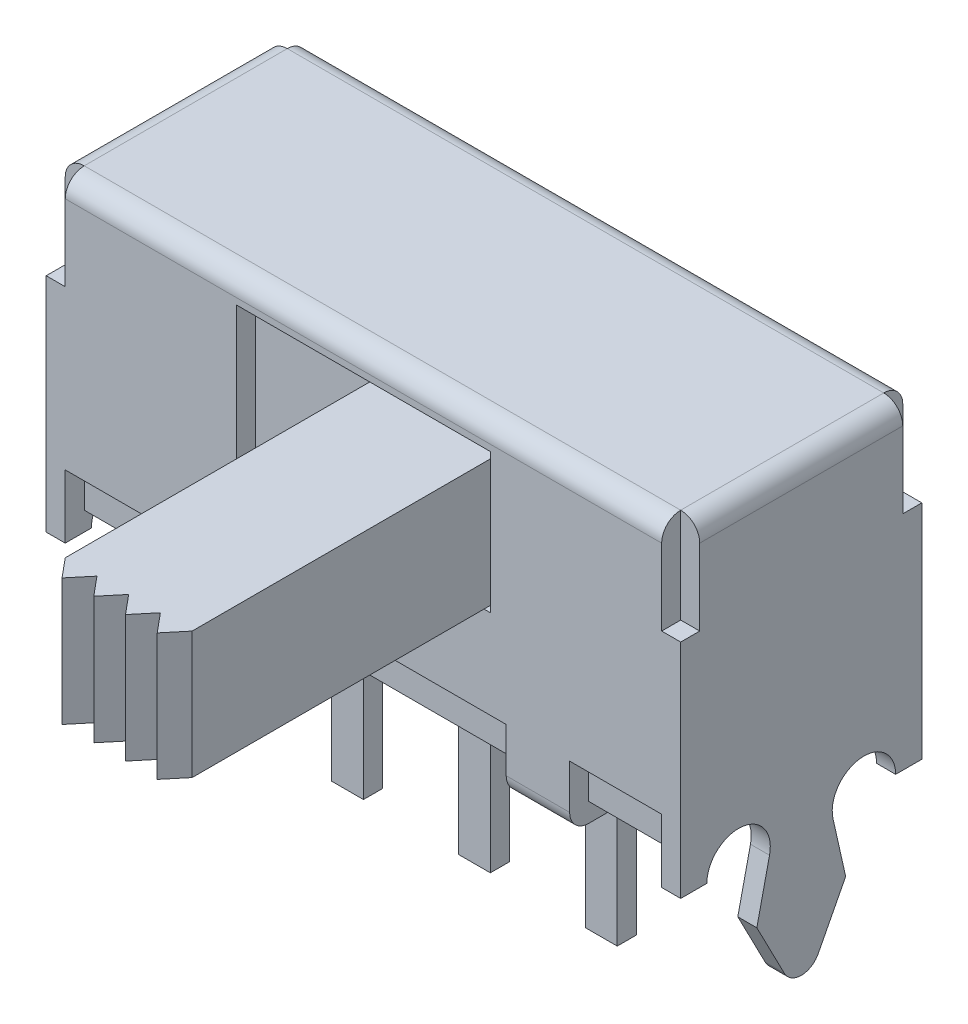
from build123d import *

# Parameters (mm, degrees)
BOSS_EXTRUDE1_DEPTH = 5
SKETCH3_OUTSIDE_W   = 14.556
SKETCH3_OUTSIDE_H   = 8.356
SKETCH3_OUTSIDE_W_2 = 0.5
SKETCH3_OUTSIDE_H_2 = 0.3
SKETCH3_OUTSIDE_W_3 = 0.3
SKETCH3_OUTSIDE_H_3 = 3.8
CUT_EXTRUDE1_DEPTH  = 8.321885003
SKETCH4_W           = 0.5
SKETCH4_H           = 0.3
BOSS_EXTRUDE2_DEPTH = 2.9
SKETCH5_W           = 1.45
SKETCH5_H           = 0.3
SKETCH5_W_2         = 4.5
CUT_EXTRUDE2_DEPTH  = 1
SKETCH6_W           = 9.4
SKETCH6_H           = 3.2
SKETCH6_W_2         = 0.5
SKETCH6_H_2         = 0.3
CUT_EXTRUDE3_DEPTH  = 0.3
SKETCH7_W           = 9.4
SKETCH7_H           = 3.2
BOSS_EXTRUDE3_DEPTH = 0.7
SKETCH8_W           = 1
SKETCH8_H           = 1
BOSS_EXTRUDE4_DEPTH = 0.3
FILLET2_R           = 0.3
SKETCH9_W           = 4
SKETCH9_H           = 2.2
CUT_EXTRUDE4_DEPTH  = 0.3
SKETCH10_W          = 2
SKETCH10_H          = 2
BOSS_EXTRUDE5_DEPTH = 5.3
CUT_EXTRUDE5_DEPTH  = 12.285831826
SKETCH12_R          = 0.125
CUT_EXTRUDE6_DEPTH  = 0.1
SKETCH13_W          = 0.3
SKETCH13_H          = 0.3
CUT_EXTRUDE7_DEPTH  = 1.5


with BuildPart() as part:
    # Sketch2 → Boss-Extrude1 (new, symmetric)
    with BuildSketch(Plane(origin=(0, 0, 0), x_dir=(0, 0, -1), z_dir=(1, 0, 0))):
        with BuildLine():
            Line((-1.6, 5), (1.6, 5))
            ThreePointArc((1.6, 5), (1.812132034, 4.912132034), (1.9, 4.7))
            Line((1.9, 4.7), (1.9, 0))
            Line((1.9, 0), (1.487845372, 0))
            ThreePointArc((1.487845372, 0), (0.932721359, 0.496952053), (0.5, -0.109575967))
            Line((0.5, -0.109575967), (0.7, -1))
            Line((0.7, -1), (0.266442453, -1.837871024))
            ThreePointArc((0.266442453, -1.837871024), (0, -2), (-0.266442453, -1.837871024))
            Line((-0.266442453, -1.837871024), (-0.7, -1))
            Line((-0.7, -1), (-0.5, -0.109575967))
            ThreePointArc((-0.5, -0.109575967), (-0.932721359, 0.496952053), (-1.487845372, 0))
            Line((-1.487845372, 0), (-1.9, 0))
            Line((-1.9, 0), (-1.9, 4.7))
            ThreePointArc((-1.9, 4.7), (-1.812132034, 4.912132034), (-1.6, 5))
        make_face()
    extrude(amount=BOSS_EXTRUDE1_DEPTH, both=True)

    # Sketch3 outside → Cut-Extrude1 (cut, through all)
    with BuildSketch(Plane.XZ):
        Rectangle(SKETCH3_OUTSIDE_W, SKETCH3_OUTSIDE_H)
        with Locations((-2, 0)):
            Rectangle(SKETCH3_OUTSIDE_W_2, SKETCH3_OUTSIDE_H_2, mode=Mode.SUBTRACT)
        Rectangle(SKETCH3_OUTSIDE_W_2, SKETCH3_OUTSIDE_H_2, mode=Mode.SUBTRACT)
        with Locations((2, 0)):
            Rectangle(SKETCH3_OUTSIDE_W_2, SKETCH3_OUTSIDE_H_2, mode=Mode.SUBTRACT)
        with Locations((-4.85, 0)):
            Rectangle(SKETCH3_OUTSIDE_W_3, SKETCH3_OUTSIDE_H_3, mode=Mode.SUBTRACT)
        with Locations((4.85, 0)):
            Rectangle(SKETCH3_OUTSIDE_W_3, SKETCH3_OUTSIDE_H_3, mode=Mode.SUBTRACT)
    extrude(amount=CUT_EXTRUDE1_DEPTH, mode=Mode.SUBTRACT)

    # Sketch4 → Boss-Extrude2 (add)
    with BuildSketch(Plane.XZ):
        with Locations((-2, 0)):
            Rectangle(SKETCH4_W, SKETCH4_H)
        Rectangle(SKETCH4_W, SKETCH4_H)
        with Locations((2, 0)):
            Rectangle(SKETCH4_W, SKETCH4_H)
    extrude(amount=BOSS_EXTRUDE2_DEPTH)

    # Sketch5 → Cut-Extrude2 (cut)
    with BuildSketch(Plane.XZ):
        with Locations((-3.975, 1.75)):
            Rectangle(SKETCH5_W, SKETCH5_H)
        with Locations((0, 1.75)):
            Rectangle(SKETCH5_W_2, SKETCH5_H)
        with Locations((3.975, 1.75)):
            Rectangle(SKETCH5_W, SKETCH5_H)
        with Locations((3.975, -1.75)):
            Rectangle(SKETCH5_W, SKETCH5_H)
        with Locations((0, -1.75)):
            Rectangle(SKETCH5_W_2, SKETCH5_H)
        with Locations((-3.975, -1.75)):
            Rectangle(SKETCH5_W, SKETCH5_H)
    extrude(amount=-CUT_EXTRUDE2_DEPTH, mode=Mode.SUBTRACT)

    # Sketch6 → Cut-Extrude3 (cut)
    with BuildSketch(Plane.XZ):
        Rectangle(SKETCH6_W, SKETCH6_H)
        with Locations((-2, 0)):
            Rectangle(SKETCH6_W_2, SKETCH6_H_2, mode=Mode.SUBTRACT)
        Rectangle(SKETCH6_W_2, SKETCH6_H_2, mode=Mode.SUBTRACT)
        with Locations((2, 0)):
            Rectangle(SKETCH6_W_2, SKETCH6_H_2, mode=Mode.SUBTRACT)
    extrude(amount=-CUT_EXTRUDE3_DEPTH, mode=Mode.SUBTRACT)

    # Sketch7 → Boss-Extrude3 (add)
    with BuildSketch(Plane.XZ.offset(-0.3)):
        Rectangle(SKETCH7_W, SKETCH7_H)
    extrude(amount=-BOSS_EXTRUDE3_DEPTH)

    # Sketch8 → Boss-Extrude4 (add)
    with BuildSketch(Plane.XZ):
        with Locations((-2.75, 1.4)):
            Rectangle(SKETCH8_W, SKETCH8_H)
        with Locations((2.75, 1.4)):
            Rectangle(SKETCH8_W, SKETCH8_H)
        with Locations((2.75, -1.4)):
            Rectangle(SKETCH8_W, SKETCH8_H)
        with Locations((-2.75, -1.4)):
            Rectangle(SKETCH8_W, SKETCH8_H)
    extrude(amount=-BOSS_EXTRUDE4_DEPTH)

    # Fillet2
    # the kernel refuses this fillet: 0.3 mm, written as the material it takes off along each edge
    with BuildSketch(Plane(origin=(-5, 5, 2.35), x_dir=(1, 0, 0), z_dir=(0, 0, -1)), Plane(origin=(5, 5, 2.35), x_dir=(0, -1, 0), z_dir=(0, 0, -1))) as fillet2_piece_1:
        with BuildLine():
            CenterArc((FILLET2_R, FILLET2_R), FILLET2_R, 180, 90)
            Line((0, FILLET2_R), (0, 0))
            Line((0, 0), (FILLET2_R, 0))
        make_face()
    extrude(amount=4.7, mode=Mode.SUBTRACT)
    with BuildSketch(Plane(origin=(1.5, 0, 1.9), x_dir=(0, 0, -1), z_dir=(1, 0, 0)), Plane(origin=(-4, 0, 1.9), x_dir=(0, 0, -1), z_dir=(1, 0, 0))) as fillet2_piece_2:
        with BuildLine():
            CenterArc((FILLET2_R, FILLET2_R), FILLET2_R, 180, 90)
            Line((0, FILLET2_R), (0, 0))
            Line((0, 0), (FILLET2_R, 0))
        make_face()
    extrude(amount=2.5, mode=Mode.SUBTRACT)
    with BuildSketch(Plane(origin=(1.5, 0, -1.9), x_dir=(0, 0, 1), z_dir=(1, 0, 0)), Plane(origin=(-4, 0, -1.9), x_dir=(0, 0, 1), z_dir=(1, 0, 0))) as fillet2_piece_3:
        with BuildLine():
            CenterArc((FILLET2_R, -FILLET2_R), FILLET2_R, 90, 90)
            Line((0, -FILLET2_R), (0, 0))
            Line((0, 0), (FILLET2_R, 0))
        make_face()
    extrude(amount=2.5, mode=Mode.SUBTRACT)

    # Sketch9 → Cut-Extrude4 (cut)
    with BuildSketch(Plane.XY.offset(1.9)):
        with Locations((0, 3.5)):
            Rectangle(SKETCH9_W, SKETCH9_H)
    extrude(amount=-CUT_EXTRUDE4_DEPTH, mode=Mode.SUBTRACT)

    # Sketch10 → Boss-Extrude5 (add)
    with BuildSketch(Plane.XY.offset(1.6)):
        with Locations((1, 3.5)):
            Rectangle(SKETCH10_W, SKETCH10_H)
    extrude(amount=BOSS_EXTRUDE5_DEPTH)

    # Sketch11 → Cut-Extrude5 (cut, through all)
    with BuildSketch(Plane(origin=(0, 4.5, 0), x_dir=(1, 0, 0), z_dir=(0, 1, 0))):
        Polygon((0, -6.6), (0.25, -6.9), (0.5, -6.6), (0.75, -6.9), (1, -6.6), (1.25, -6.9), (1.5, -6.6), (1.75, -6.9), (2, -6.6), (2.5, -6.6), (2.5, -7.4), (-0.5, -7.4), (-0.5, -6.6), align=None)
    extrude(amount=-CUT_EXTRUDE5_DEPTH, mode=Mode.SUBTRACT)

    # Sketch12 → Cut-Extrude6 (cut)
    with BuildSketch(Plane.XZ.offset(2.9)):
        with Locations(Location((-2, 0, 0), (0, 0, 270))):
            Circle(SKETCH12_R)
        with Locations(Location((2, 0, 0), (0, 0, 270))):
            Circle(SKETCH12_R)
    extrude(amount=-CUT_EXTRUDE6_DEPTH, mode=Mode.SUBTRACT)

    # Sketch13 → Cut-Extrude7 (cut)
    with BuildSketch(Plane(origin=(0, 5, 0), x_dir=(1, 0, 0), z_dir=(0, 1, 0))):
        with Locations((-4.85, -1.75)):
            Rectangle(SKETCH13_W, SKETCH13_H)
        with Locations((-4.85, 1.75)):
            Rectangle(SKETCH13_W, SKETCH13_H)
        with Locations((4.85, 1.75)):
            Rectangle(SKETCH13_W, SKETCH13_H)
        with Locations((4.85, -1.75)):
            Rectangle(SKETCH13_W, SKETCH13_H)
    extrude(amount=-CUT_EXTRUDE7_DEPTH, mode=Mode.SUBTRACT)


solid = part.part
